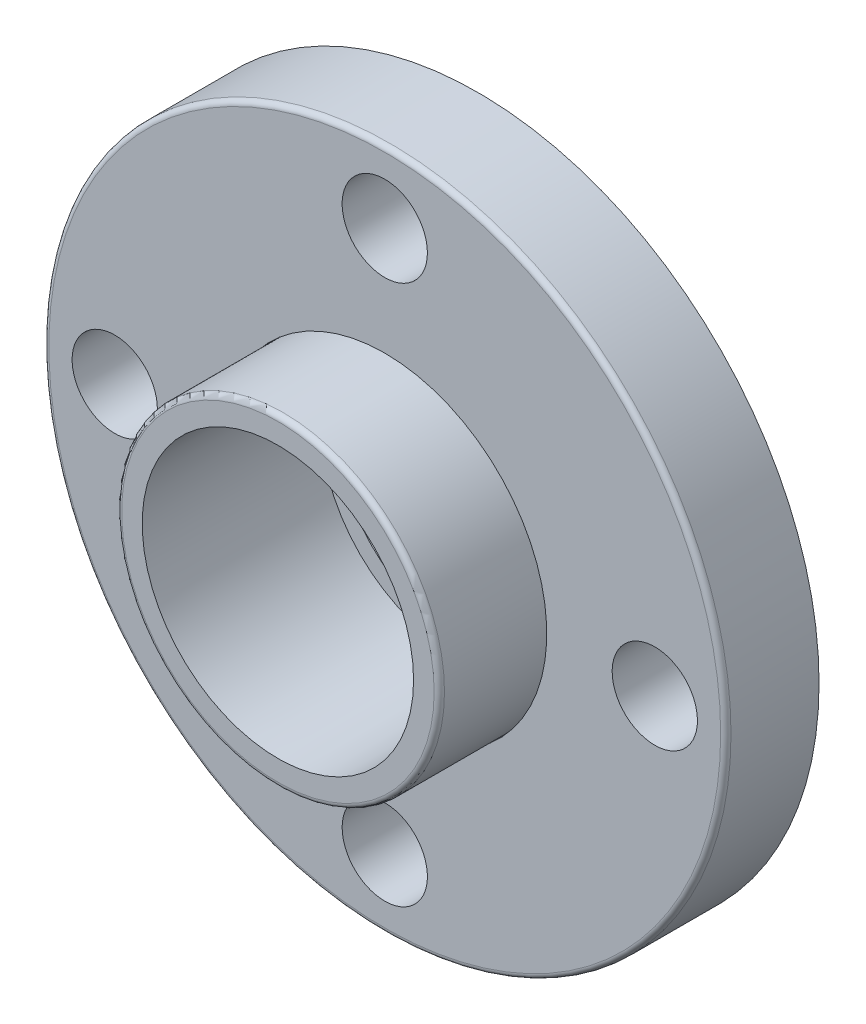
from build123d import *

# Parameters (mm, degrees)
SKETCH1_R                       = 76.2
EXTRUDE1_DEPTH                  = 20.828
SKETCH2_R                       = 36.068
EXTRUDE2_DEPTH                  = 23.876
SKETCH3_R                       = 9.525
EXTRUDE3_DEPTH                  = 111.376371457
CIRPATTERN1_COUNT               = 4
FILLET1_R                       = 1.154545455
CUT_REVOLVE_THIN1_OUTLINE_R     = 44.577
CUT_REVOLVE_THIN1_OUTLINE_R_2   = 44.45
CUT_REVOLVE_THIN1_DEPTH         = 9.963727273
CUT_REVOLVE_THIN1_START         = 9.836727273
CUT_REVOLVE_THIN1_2_OUTLINE_R   = 36.195
CUT_REVOLVE_THIN1_2_OUTLINE_R_2 = 36.068
CUT_REVOLVE_THIN1_2_DEPTH       = 10.991272727
CUT_REVOLVE_THIN1_3_OUTLINE_R   = 44.45
CUT_REVOLVE_THIN1_3_OUTLINE_R_2 = 36.195
CUT_REVOLVE_THIN1_3_DEPTH       = 0.127


# Read off the part's stored shape, not the designer's step: Cut-Revolve-Thin1
with BuildPart() as part:
    # Sketch1 → Extrude1 (new body)
    with BuildSketch(Plane.XY):
        Circle(SKETCH1_R)
    extrude(amount=EXTRUDE1_DEPTH)

    # Sketch2 → Extrude2 (add)
    with BuildSketch(Plane.XY.offset(20.828)):
        Circle(SKETCH2_R)
    extrude(amount=EXTRUDE2_DEPTH)

    # Sketch3 → Extrude3 (cut, through all)
    with BuildSketch(Plane.XY.offset(20.828)):
        with Locations((0, 60.325)):
            Circle(SKETCH3_R)
    extrude3 = extrude(amount=-EXTRUDE3_DEPTH, mode=Mode.SUBTRACT)

    # CirPattern1: Extrude3 ×4 about axis
    cirpattern1_axis = Axis((0, 0, 0), (0, 0, 1))
    for i in range(1, CIRPATTERN1_COUNT):
        add(extrude3.rotate(cirpattern1_axis, i * 360 / CIRPATTERN1_COUNT), mode=Mode.SUBTRACT)

    # Fillet1
    fillet1_edges = [part.edges().sort_by_distance(p)[0] for p in [
        (-76.2, 0, 20.828),
        (-36.068, 0, 44.704),
    ]]
    fillet(fillet1_edges, radius=FILLET1_R)

    # Sketch4 → Cut-Revolve1 (revolve, cut)
    with BuildSketch(Plane(origin=(0, 0, 62.70625), x_dir=(0, 0, 1), z_dir=(-1, 0, 0)), mode=Mode.PRIVATE) as cut_revolve1_sk:
        Polygon((-62.70625, 26.162), (-57.62625, 26.162), (-57.62625, 30.0863), (-18.00225, 30.3149), (-18.00225, 0), (-62.70625, 0), align=None)
    revolve(cut_revolve1_sk.sketch.rotate(Axis((0, 0, 44.704), (0, 0, -1)), 90), axis=Axis((0, 0, 44.704), (0, 0, -1)), mode=Mode.SUBTRACT)

    # Cut-Revolve-Thin1 outline → Cut-Revolve-Thin1 (cut)
    with BuildSketch(Plane.XY):
        Circle(CUT_REVOLVE_THIN1_OUTLINE_R)
        Circle(CUT_REVOLVE_THIN1_OUTLINE_R_2, mode=Mode.SUBTRACT)
    extrude(amount=CUT_REVOLVE_THIN1_DEPTH, mode=Mode.SUBTRACT)

    # Cut-Revolve-Thin1 2 outline → Cut-Revolve-Thin1 2 (cut)
    with BuildSketch(Plane.XY.offset(CUT_REVOLVE_THIN1_START)):
        Circle(CUT_REVOLVE_THIN1_2_OUTLINE_R)
        Circle(CUT_REVOLVE_THIN1_2_OUTLINE_R_2, mode=Mode.SUBTRACT)
    extrude(amount=CUT_REVOLVE_THIN1_2_DEPTH, mode=Mode.SUBTRACT)

    # Cut-Revolve-Thin1 3 outline → Cut-Revolve-Thin1 3 (cut)
    with BuildSketch(Plane.XY.offset(CUT_REVOLVE_THIN1_START)):
        Circle(CUT_REVOLVE_THIN1_3_OUTLINE_R)
        Circle(CUT_REVOLVE_THIN1_3_OUTLINE_R_2, mode=Mode.SUBTRACT)
    extrude(amount=CUT_REVOLVE_THIN1_3_DEPTH, mode=Mode.SUBTRACT)


solid = part.part
